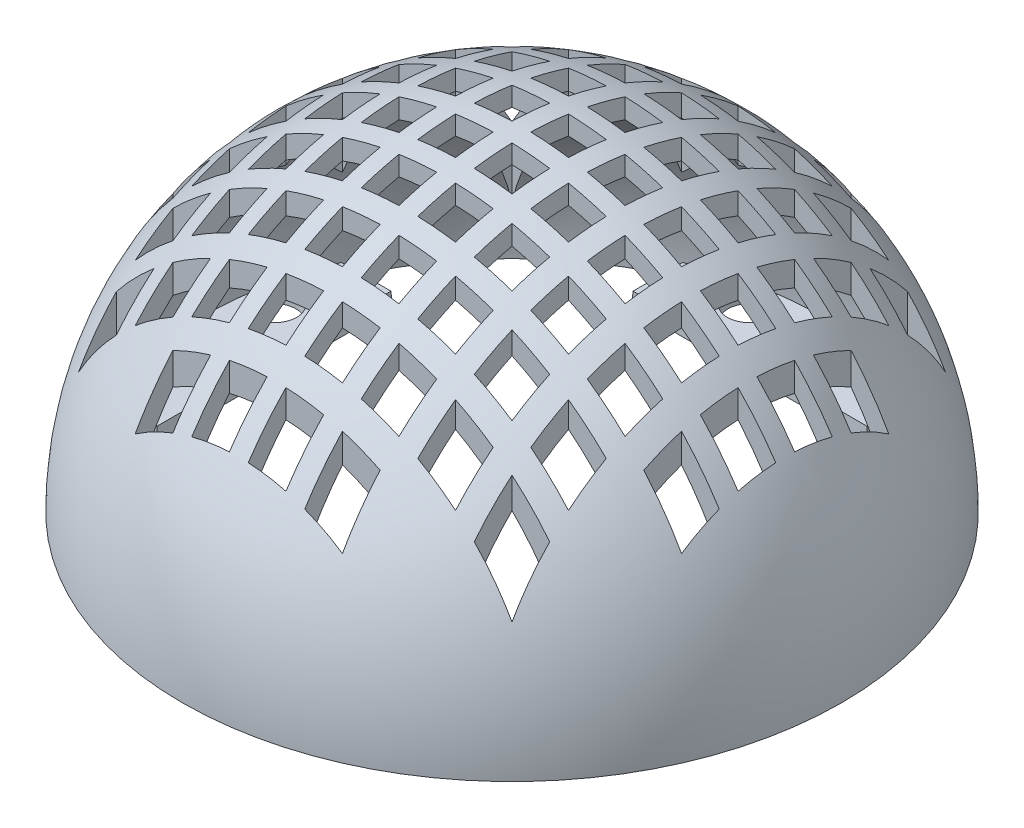
from build123d import *

# Parameters (mm, degrees)
REVOLVE1_ANGLE                = 180
CUT_REVOLVE1_ANGLE            = 180
CUT_EXTRUDE1_START            = 0.057166
SKETCH4_W                     = 8
SKETCH4_H                     = 8
CUT_EXTRUDE1_DEPTH            = 58.807305
SKETCH5_R                     = 4.5
BOSS_EXTRUDE1_DEPTH           = 3
BOSS_EXTRUDE1_DRAFT           = 3
BOSS_EXTRUDE1_PROFILE_2_DEPTH = 3
BOSS_EXTRUDE1_PROFILE_2_DRAFT = 3
BOSS_EXTRUDE1_PROFILE_3_DEPTH = 3
BOSS_EXTRUDE1_PROFILE_3_DRAFT = 3
BOSS_EXTRUDE1_PROFILE_4_DEPTH = 3
BOSS_EXTRUDE1_PROFILE_4_DRAFT = 3


with BuildPart() as part:
    # Sketch1 → Revolve1 (revolve)
    with BuildSketch(Plane(origin=(0, 0, 0), x_dir=(1, 0, 0), z_dir=(0, 1, 0))):
        with BuildLine():
            Line((0, -70), (0, 70))
            ThreePointArc((0, 70), (-70, 0), (0, -70))
        make_face()
    revolve(axis=Axis((0, 0, 0), (0, 0, -1)), revolution_arc=REVOLVE1_ANGLE)

    # Sketch3 → Cut-Revolve1 (revolve, cut)
    with BuildSketch(Plane.XZ):
        with BuildLine():
            Line((0, -66), (0, 66))
            ThreePointArc((0, 66), (-66, 0), (0, -66))
        make_face()
    revolve(axis=Axis((0, 0, 0), (0, 0, -1)), revolution_arc=CUT_REVOLVE1_ANGLE, mode=Mode.SUBTRACT)

    # Sketch4 → Cut-Extrude1 (cut)
    with BuildSketch(Plane(origin=(0, 70, 0), x_dir=(-1, 0, 0), z_dir=(0, -1, 0)).offset(CUT_EXTRUDE1_START)):
        with Locations((-6, 6)):
            Rectangle(SKETCH4_W, SKETCH4_H)
        with Locations((-18, 6)):
            Rectangle(SKETCH4_W, SKETCH4_H)
        with Locations((-30, 6)):
            Rectangle(SKETCH4_W, SKETCH4_H)
        with Locations((-42, 6)):
            Rectangle(SKETCH4_W, SKETCH4_H)
        with Locations((-54, 6)):
            Rectangle(SKETCH4_W, SKETCH4_H)
        with Locations((-18, 18)):
            Rectangle(SKETCH4_W, SKETCH4_H)
        with Locations((-30, 18)):
            Rectangle(SKETCH4_W, SKETCH4_H)
        with Locations((-42, 18)):
            Rectangle(SKETCH4_W, SKETCH4_H)
        with Locations((-54, 18)):
            Rectangle(SKETCH4_W, SKETCH4_H)
        with Locations((-18, 30)):
            Rectangle(SKETCH4_W, SKETCH4_H)
        with Locations((-30, 30)):
            Rectangle(SKETCH4_W, SKETCH4_H)
        with Locations((-42, 30)):
            Rectangle(SKETCH4_W, SKETCH4_H)
        with Locations((-18, 42)):
            Rectangle(SKETCH4_W, SKETCH4_H)
        with Locations((-30, 42)):
            Rectangle(SKETCH4_W, SKETCH4_H)
        with Locations((-42, 42)):
            Rectangle(SKETCH4_W, SKETCH4_H)
        with Locations((-18, 54)):
            Rectangle(SKETCH4_W, SKETCH4_H)
        with Locations((-6, 18)):
            Rectangle(SKETCH4_W, SKETCH4_H)
        with Locations((-6, 30)):
            Rectangle(SKETCH4_W, SKETCH4_H)
        with Locations((-6, 42)):
            Rectangle(SKETCH4_W, SKETCH4_H)
        with Locations((-6, 54)):
            Rectangle(SKETCH4_W, SKETCH4_H)
        with Locations((6, 54)):
            Rectangle(SKETCH4_W, SKETCH4_H)
        with Locations((6, 42)):
            Rectangle(SKETCH4_W, SKETCH4_H)
        with Locations((6, 30)):
            Rectangle(SKETCH4_W, SKETCH4_H)
        with Locations((6, 18)):
            Rectangle(SKETCH4_W, SKETCH4_H)
        with Locations((18, 54)):
            Rectangle(SKETCH4_W, SKETCH4_H)
        with Locations((42, 42)):
            Rectangle(SKETCH4_W, SKETCH4_H)
        with Locations((30, 42)):
            Rectangle(SKETCH4_W, SKETCH4_H)
        with Locations((18, 42)):
            Rectangle(SKETCH4_W, SKETCH4_H)
        with Locations((42, 30)):
            Rectangle(SKETCH4_W, SKETCH4_H)
        with Locations((30, 30)):
            Rectangle(SKETCH4_W, SKETCH4_H)
        with Locations((18, 30)):
            Rectangle(SKETCH4_W, SKETCH4_H)
        with Locations((54, 18)):
            Rectangle(SKETCH4_W, SKETCH4_H)
        with Locations((42, 18)):
            Rectangle(SKETCH4_W, SKETCH4_H)
        with Locations((30, 18)):
            Rectangle(SKETCH4_W, SKETCH4_H)
        with Locations((18, 18)):
            Rectangle(SKETCH4_W, SKETCH4_H)
        with Locations((54, 6)):
            Rectangle(SKETCH4_W, SKETCH4_H)
        with Locations((42, 6)):
            Rectangle(SKETCH4_W, SKETCH4_H)
        with Locations((30, 6)):
            Rectangle(SKETCH4_W, SKETCH4_H)
        with Locations((18, 6)):
            Rectangle(SKETCH4_W, SKETCH4_H)
        with Locations((6, 6)):
            Rectangle(SKETCH4_W, SKETCH4_H)
        with Locations((6, -6)):
            Rectangle(SKETCH4_W, SKETCH4_H)
        with Locations((18, -6)):
            Rectangle(SKETCH4_W, SKETCH4_H)
        with Locations((30, -6)):
            Rectangle(SKETCH4_W, SKETCH4_H)
        with Locations((42, -6)):
            Rectangle(SKETCH4_W, SKETCH4_H)
        with Locations((54, -6)):
            Rectangle(SKETCH4_W, SKETCH4_H)
        with Locations((18, -18)):
            Rectangle(SKETCH4_W, SKETCH4_H)
        with Locations((30, -18)):
            Rectangle(SKETCH4_W, SKETCH4_H)
        with Locations((42, -18)):
            Rectangle(SKETCH4_W, SKETCH4_H)
        with Locations((54, -18)):
            Rectangle(SKETCH4_W, SKETCH4_H)
        with Locations((18, -30)):
            Rectangle(SKETCH4_W, SKETCH4_H)
        with Locations((30, -30)):
            Rectangle(SKETCH4_W, SKETCH4_H)
        with Locations((42, -30)):
            Rectangle(SKETCH4_W, SKETCH4_H)
        with Locations((18, -42)):
            Rectangle(SKETCH4_W, SKETCH4_H)
        with Locations((30, -42)):
            Rectangle(SKETCH4_W, SKETCH4_H)
        with Locations((42, -42)):
            Rectangle(SKETCH4_W, SKETCH4_H)
        with Locations((18, -54)):
            Rectangle(SKETCH4_W, SKETCH4_H)
        with Locations((6, -18)):
            Rectangle(SKETCH4_W, SKETCH4_H)
        with Locations((6, -30)):
            Rectangle(SKETCH4_W, SKETCH4_H)
        with Locations((6, -42)):
            Rectangle(SKETCH4_W, SKETCH4_H)
        with Locations((6, -54)):
            Rectangle(SKETCH4_W, SKETCH4_H)
        with Locations((-6, -54)):
            Rectangle(SKETCH4_W, SKETCH4_H)
        with Locations((-6, -42)):
            Rectangle(SKETCH4_W, SKETCH4_H)
        with Locations((-6, -30)):
            Rectangle(SKETCH4_W, SKETCH4_H)
        with Locations((-6, -18)):
            Rectangle(SKETCH4_W, SKETCH4_H)
        with Locations((-18, -54)):
            Rectangle(SKETCH4_W, SKETCH4_H)
        with Locations((-42, -42)):
            Rectangle(SKETCH4_W, SKETCH4_H)
        with Locations((-30, -42)):
            Rectangle(SKETCH4_W, SKETCH4_H)
        with Locations((-18, -42)):
            Rectangle(SKETCH4_W, SKETCH4_H)
        with Locations((-42, -30)):
            Rectangle(SKETCH4_W, SKETCH4_H)
        with Locations((-30, -30)):
            Rectangle(SKETCH4_W, SKETCH4_H)
        with Locations((-18, -30)):
            Rectangle(SKETCH4_W, SKETCH4_H)
        with Locations((-54, -18)):
            Rectangle(SKETCH4_W, SKETCH4_H)
        with Locations((-42, -18)):
            Rectangle(SKETCH4_W, SKETCH4_H)
        with Locations((-30, -18)):
            Rectangle(SKETCH4_W, SKETCH4_H)
        with Locations((-18, -18)):
            Rectangle(SKETCH4_W, SKETCH4_H)
        with Locations((-54, -6)):
            Rectangle(SKETCH4_W, SKETCH4_H)
        with Locations((-42, -6)):
            Rectangle(SKETCH4_W, SKETCH4_H)
        with Locations((-30, -6)):
            Rectangle(SKETCH4_W, SKETCH4_H)
        with Locations((-18, -6)):
            Rectangle(SKETCH4_W, SKETCH4_H)
        with Locations((-6, -6)):
            Rectangle(SKETCH4_W, SKETCH4_H)
    extrude(amount=CUT_EXTRUDE1_DEPTH, mode=Mode.SUBTRACT)


with BuildPart() as boss_extrude1_tool:
    # Sketch5 → Boss-Extrude1 (with draft: the straight prism first)
    with BuildSketch(Plane(origin=(0, 0, 0), x_dir=(1, 0, 0), z_dir=(0, 1, 0))):
        with BuildLine():
            Line((-50.383484153, -25), (-50.383484153, 25))
            Line((-50.383484153, 25), (-65.383484153, 25))
            ThreePointArc((-65.383484153, 25), (-70, 0), (-65.383484153, -25))
            Line((-65.383484153, -25), (-50.383484153, -25))
        make_face()
        with Locations((-60.383484153, -10)):
            Circle(SKETCH5_R, mode=Mode.SUBTRACT)
        with Locations((-60.383484153, 10)):
            Circle(SKETCH5_R, mode=Mode.SUBTRACT)
    extrude(amount=BOSS_EXTRUDE1_DEPTH)
    # Boss-Extrude1: the draft: its side faces are tilted about the plane it starts from
    boss_extrude1_sides = [boss_extrude1_tool.faces().sort_by_distance(p)[0] for p in [
        (-57.883484153, 1.5, 25),
        (-50.383484153, 1.5, 0),
        (-57.883484153, 1.5, -25),
        (-70, 1.5, 0),
        (-64.883484153, 1.5, 10),
        (-64.883484153, 1.5, -10),
    ]]
    draft(boss_extrude1_sides, Plane(origin=(0, 0, 0), x_dir=(1, 0, 0), z_dir=(0, 1, 0)), BOSS_EXTRUDE1_DRAFT)


with BuildPart() as part_1:
    add(part.part)

    # Boss-Extrude1: add boss_extrude1_tool
    add(boss_extrude1_tool.part)


with BuildPart() as boss_extrude1_profile_2_tool:
    # Sketch5 → Boss-Extrude1 profile 2 (with draft: the straight prism first)
    with BuildSketch(Plane(origin=(0, 0, 0), x_dir=(1, 0, 0), z_dir=(0, 1, 0))):
        with BuildLine():
            Line((-25, 50.383484153), (25, 50.383484153))
            Line((25, 50.383484153), (25, 65.383484153))
            ThreePointArc((25, 65.383484153), (0, 70), (-25, 65.383484153))
            Line((-25, 65.383484153), (-25, 50.383484153))
        make_face()
        with Locations((-10, 60.383484153)):
            Circle(SKETCH5_R, mode=Mode.SUBTRACT)
        with Locations((10, 60.383484153)):
            Circle(SKETCH5_R, mode=Mode.SUBTRACT)
    extrude(amount=BOSS_EXTRUDE1_PROFILE_2_DEPTH)
    # Boss-Extrude1 profile 2: the draft: its side faces are tilted about the plane it starts from
    boss_extrude1_profile_2_sides = [boss_extrude1_profile_2_tool.faces().sort_by_distance(p)[0] for p in [
        (-25, 1.5, -57.883484153),
        (0, 1.5, -50.383484153),
        (25, 1.5, -57.883484153),
        (0, 1.5, -70),
        (-14.5, 1.5, -60.383484153),
        (5.5, 1.5, -60.383484153),
    ]]
    draft(boss_extrude1_profile_2_sides, Plane(origin=(0, 0, 0), x_dir=(1, 0, 0), z_dir=(0, 1, 0)), BOSS_EXTRUDE1_PROFILE_2_DRAFT)


with BuildPart() as part_2:
    add(part_1.part)

    # Boss-Extrude1 profile 2: add boss_extrude1_profile_2_tool
    add(boss_extrude1_profile_2_tool.part)


with BuildPart() as boss_extrude1_profile_3_tool:
    # Sketch5 → Boss-Extrude1 profile 3 (with draft: the straight prism first)
    with BuildSketch(Plane(origin=(0, 0, 0), x_dir=(1, 0, 0), z_dir=(0, 1, 0))):
        with BuildLine():
            Line((50.383484153, 25), (50.383484153, -25))
            Line((50.383484153, -25), (65.383484153, -25))
            ThreePointArc((65.383484153, -25), (70, 0), (65.383484153, 25))
            Line((65.383484153, 25), (50.383484153, 25))
        make_face()
        with Locations((60.383484153, 10)):
            Circle(SKETCH5_R, mode=Mode.SUBTRACT)
        with Locations((60.383484153, -10)):
            Circle(SKETCH5_R, mode=Mode.SUBTRACT)
    extrude(amount=BOSS_EXTRUDE1_PROFILE_3_DEPTH)
    # Boss-Extrude1 profile 3: the draft: its side faces are tilted about the plane it starts from
    boss_extrude1_profile_3_sides = [boss_extrude1_profile_3_tool.faces().sort_by_distance(p)[0] for p in [
        (57.883484153, 1.5, -25),
        (50.383484153, 1.5, 0),
        (57.883484153, 1.5, 25),
        (70, 1.5, 0),
        (55.883484153, 1.5, -10),
        (55.883484153, 1.5, 10),
    ]]
    draft(boss_extrude1_profile_3_sides, Plane(origin=(0, 0, 0), x_dir=(1, 0, 0), z_dir=(0, 1, 0)), BOSS_EXTRUDE1_PROFILE_3_DRAFT)


with BuildPart() as part_3:
    add(part_2.part)

    # Boss-Extrude1 profile 3: add boss_extrude1_profile_3_tool
    add(boss_extrude1_profile_3_tool.part)


with BuildPart() as boss_extrude1_profile_4_tool:
    # Sketch5 → Boss-Extrude1 profile 4 (with draft: the straight prism first)
    with BuildSketch(Plane(origin=(0, 0, 0), x_dir=(1, 0, 0), z_dir=(0, 1, 0))):
        with BuildLine():
            Line((25, -50.383484153), (-25, -50.383484153))
            Line((-25, -50.383484153), (-25, -65.383484153))
            ThreePointArc((-25, -65.383484153), (0, -70), (25, -65.383484153))
            Line((25, -65.383484153), (25, -50.383484153))
        make_face()
        with Locations((10, -60.383484153)):
            Circle(SKETCH5_R, mode=Mode.SUBTRACT)
        with Locations((-10, -60.383484153)):
            Circle(SKETCH5_R, mode=Mode.SUBTRACT)
    extrude(amount=BOSS_EXTRUDE1_PROFILE_4_DEPTH)
    # Boss-Extrude1 profile 4: the draft: its side faces are tilted about the plane it starts from
    boss_extrude1_profile_4_sides = [boss_extrude1_profile_4_tool.faces().sort_by_distance(p)[0] for p in [
        (25, 1.5, 57.883484153),
        (0, 1.5, 50.383484153),
        (-25, 1.5, 57.883484153),
        (0, 1.5, 70),
        (5.5, 1.5, 60.383484153),
        (-14.5, 1.5, 60.383484153),
    ]]
    draft(boss_extrude1_profile_4_sides, Plane(origin=(0, 0, 0), x_dir=(1, 0, 0), z_dir=(0, 1, 0)), BOSS_EXTRUDE1_PROFILE_4_DRAFT)


with BuildPart() as part_4:
    add(part_3.part)

    # Boss-Extrude1 profile 4: add boss_extrude1_profile_4_tool
    add(boss_extrude1_profile_4_tool.part)


solid = part_4.part
